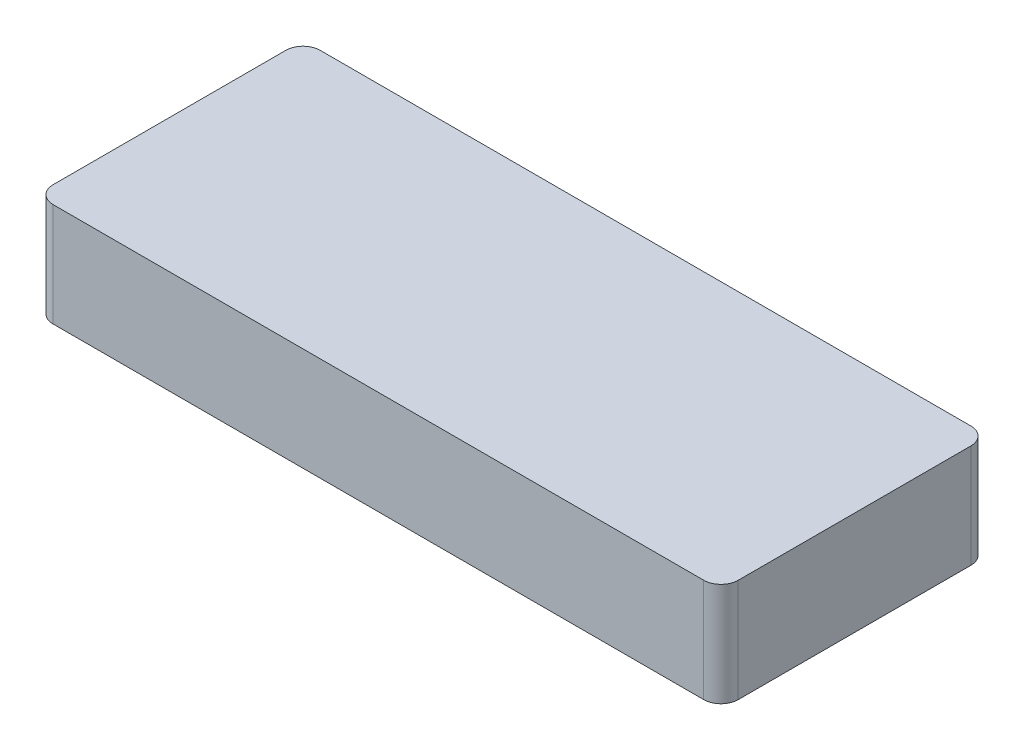
from build123d import *

# Parameters (mm, degrees)
SKETCH1_W           = 79.5
SKETCH1_H           = 31
BOSS_EXTRUDE1_DEPTH = 12
FILLET1_R           = 2
SHELL1_START        = -37.75
SHELL1_OUTLINE_W    = 8
SHELL1_OUTLINE_H    = 27
SHELL1_DEPTH        = 75.5


# Read off the part's stored shape, not the designer's step: Shell1
with BuildPart() as part:
    # Sketch1 → Boss-Extrude1 (new body)
    with BuildSketch(Plane(origin=(0, 0, 0), x_dir=(1, 0, 0), z_dir=(0, 1, 0))):
        Rectangle(SKETCH1_W, SKETCH1_H)
    extrude(amount=BOSS_EXTRUDE1_DEPTH)

    # Fillet1
    fillet1_edges = [part.edges().sort_by_distance(p)[0] for p in [
        (-39.75, 6, -15.5),
        (39.75, 6, -15.5),
        (39.75, 6, 15.5),
        (-39.75, 6, 15.5),
    ]]
    fillet(fillet1_edges, radius=FILLET1_R)

    # Shell1 outline → Shell1 (cut)
    with BuildSketch(Plane.YZ.offset(SHELL1_START)):
        with Locations((6, 0)):
            Rectangle(SHELL1_OUTLINE_W, SHELL1_OUTLINE_H)
    extrude(amount=SHELL1_DEPTH, mode=Mode.SUBTRACT)


solid = part.part
